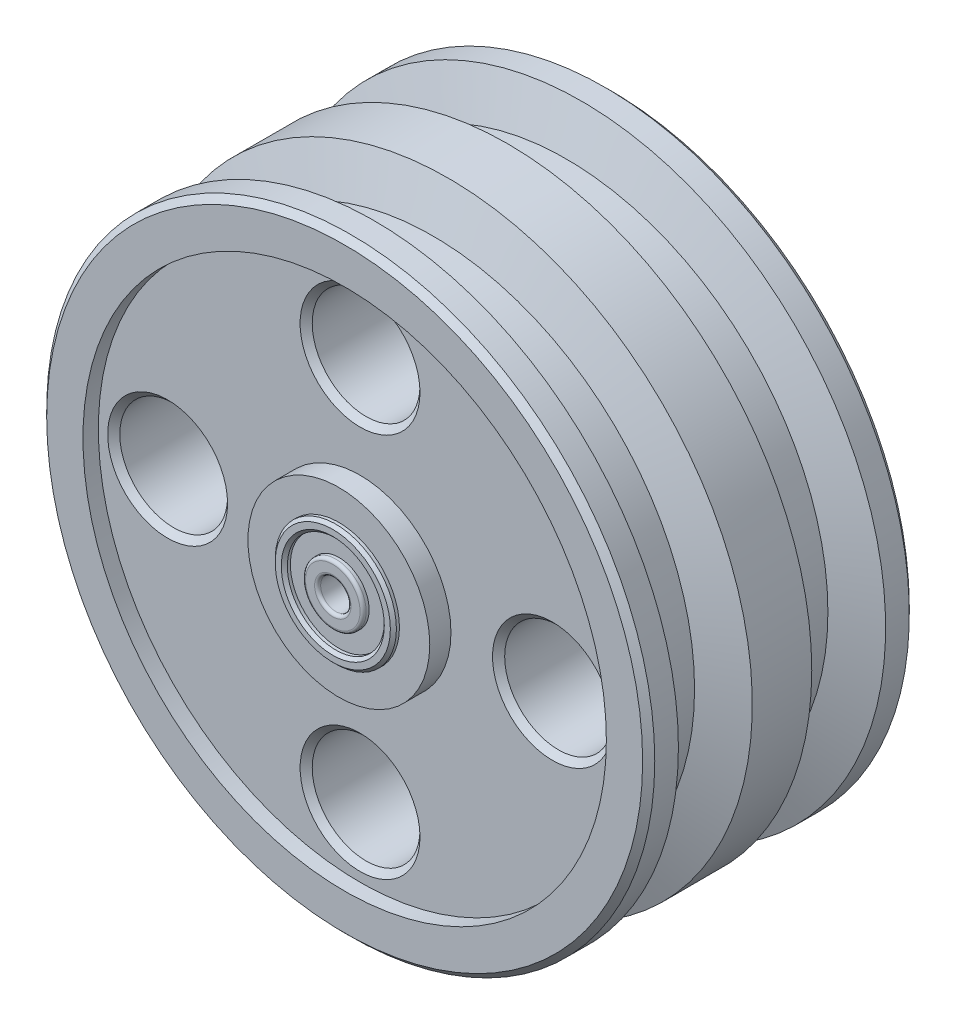
from build123d import *

# Parameters (mm, degrees)
SKETCH2_R            = 50.165
BOSS_EXTRUDE1_DEPTH  = 10
SKETCH4_R            = 43.18
BOSS_EXTRUDE2_DEPTH  = 2
SKETCH5_R            = 50.165
BOSS_EXTRUDE3_DEPTH  = 20
SKETCH7_R            = 43.18
BOSS_EXTRUDE4_DEPTH  = 2
SKETCH8_R            = 50.165
BOSS_EXTRUDE5_DEPTH  = 10
CHAMFER1_SIZE        = 14
CHAMFER1_SIZE_2      = 5.09558328
CHAMFER2_SIZE        = 5.09558328
CHAMFER2_SIZE_2      = 14
CHAMFER4_SIZE        = 14
CHAMFER4_SIZE_2      = 5.09558328
CHAMFER5_SIZE        = 5.09558328
CHAMFER5_SIZE_2      = 14
SKETCH13_R           = 43.18
CUT_EXTRUDE3_DEPTH   = 2.54
SKETCH18_R           = 15
BOSS_EXTRUDE12_DEPTH = 3.5
SKETCH19_R           = 10
BOSS_EXTRUDE13_DEPTH = 1
SKETCH20_R           = 8
SKETCH20_R_2         = 5
CUT_EXTRUDE4_DEPTH   = 1
CUT_EXTRUDE5_START   = -2.54
SKETCH22_R           = 43.18
SKETCH22_R_2         = 15
CUT_EXTRUDE5_DEPTH   = 2.54
SKETCH23_R           = 15
BOSS_EXTRUDE14_DEPTH = 1
BOSS_EXTRUDE15_START = 1
SKETCH24_R           = 10
BOSS_EXTRUDE15_DEPTH = 1
CUT_EXTRUDE6_START   = -1
SKETCH25_R           = 8
SKETCH25_R_2         = 5
CUT_EXTRUDE6_DEPTH   = 1
SKETCH26_R           = 2.5
CUT_EXTRUDE7_DEPTH   = 86.634199068
CHAMFER9_SIZE        = 0.5
FILLET1_R            = 0.5
FILLET2_R            = 0.5
CHAMFER10_SIZE       = 0.5
CHAMFER11_SIZE       = 0.5
FILLET3_R            = 0.5
SKETCH29_R           = 8.89
CUT_EXTRUDE9_DEPTH   = 85.530326215
CHAMFER12_SIZE       = 1
CHAMFER13_SIZE       = 1


with BuildPart() as part:
    # Sketch2 → Boss-Extrude1 (new body)
    with BuildSketch(Plane.XY):
        Circle(SKETCH2_R)
    extrude(amount=-BOSS_EXTRUDE1_DEPTH)

    # Sketch4 → Boss-Extrude2 (add)
    with BuildSketch(Plane(origin=(0, 0, -10), x_dir=(-1, 0, 0), z_dir=(0, 0, -1))):
        with Locations(Location((0, 0, 0), (0, 0, 180))):
            Circle(SKETCH4_R)
    extrude(amount=BOSS_EXTRUDE2_DEPTH)

    # Sketch5 → Boss-Extrude3 (add)
    with BuildSketch(Plane(origin=(0, 0, -12), x_dir=(-1, 0, 0), z_dir=(0, 0, -1))):
        with Locations(Location((0, 0, 0), (0, 0, 180))):
            Circle(SKETCH5_R)
    extrude(amount=BOSS_EXTRUDE3_DEPTH)

    # Sketch7 → Boss-Extrude4 (add)
    with BuildSketch(Plane(origin=(0, 0, -32), x_dir=(-1, 0, 0), z_dir=(0, 0, -1))):
        with Locations(Location((0, 0, 0), (0, 0, 180))):
            Circle(SKETCH7_R)
    extrude(amount=BOSS_EXTRUDE4_DEPTH)

    # Sketch8 → Boss-Extrude5 (add)
    with BuildSketch(Plane(origin=(0, 0, -34), x_dir=(-1, 0, 0), z_dir=(0, 0, -1))):
        with Locations(Location((0, 0, 0), (0, 0, 180))):
            Circle(SKETCH8_R)
    extrude(amount=BOSS_EXTRUDE5_DEPTH)

    # Chamfer1
    # the kernel refuses this chamfer: 14, 5.09558328 mm, written as the material it takes off along each edge
    with BuildSketch(Plane(origin=(0, 0, -10), x_dir=(1, 0, 0), z_dir=(0, -1, 0))) as chamfer1_piece_1_section:
        Polygon((50.165 - CHAMFER1_SIZE, 0), (50.165, CHAMFER1_SIZE_2), (50.165, 0), align=None)
    chamfer1_piece_1 = revolve(axis=Axis((0, 0, -10), (0, 0, 1)), mode=Mode.PRIVATE)
    chamfer1_piece_1 = chamfer1_piece_1 - Plane(origin=(0, 0, -6.275641512), x_dir=(1, 0, 0), z_dir=(0, 0, 1)) * Cylinder(43.18, 201, mode=Mode.PRIVATE)
    add(chamfer1_piece_1, mode=Mode.SUBTRACT)

    # Chamfer2
    # the kernel refuses this chamfer: 14, 5.09558328 mm, written as the material it takes off along each edge
    with BuildSketch(Plane(origin=(0, 0, -12), x_dir=(1, 0, 0), z_dir=(0, 1, 0))) as chamfer2_piece_1_section:
        Polygon((50.165, CHAMFER2_SIZE), (50.165 - CHAMFER2_SIZE_2, 0), (50.165, 0), align=None)
    chamfer2_piece_1 = revolve(axis=Axis((0, 0, -12), (0, 0, -1)), mode=Mode.PRIVATE)
    chamfer2_piece_1 = chamfer2_piece_1 - Plane(origin=(0, 0, -15.724358488), x_dir=(1, 0, 0), z_dir=(0, 0, 1)) * Cylinder(43.18, 201, mode=Mode.PRIVATE)
    add(chamfer2_piece_1, mode=Mode.SUBTRACT)

    # Chamfer4
    # the kernel refuses this chamfer: 14, 5.09558328 mm, written as the material it takes off along each edge
    with BuildSketch(Plane(origin=(0, 0, -32), x_dir=(1, 0, 0), z_dir=(0, 1, 0))) as chamfer4_piece_1_section:
        Polygon((50.165 - CHAMFER4_SIZE, 0), (50.165, -CHAMFER4_SIZE_2), (50.165, 0), align=None)
    chamfer4_piece_1 = revolve(axis=Axis((0, 0, -32), (0, 0, -1)), mode=Mode.PRIVATE)
    chamfer4_piece_1 = chamfer4_piece_1 - Plane(origin=(0, 0, -28.275641512), x_dir=(1, 0, 0), z_dir=(0, 0, 1)) * Cylinder(43.18, 201, mode=Mode.PRIVATE)
    add(chamfer4_piece_1, mode=Mode.SUBTRACT)

    # Chamfer5
    # the kernel refuses this chamfer: 14, 5.09558328 mm, written as the material it takes off along each edge
    with BuildSketch(Plane(origin=(0, 0, -34), x_dir=(1, 0, 0), z_dir=(0, 1, 0))) as chamfer5_piece_1_section:
        Polygon((50.165, CHAMFER5_SIZE), (50.165 - CHAMFER5_SIZE_2, 0), (50.165, 0), align=None)
    chamfer5_piece_1 = revolve(axis=Axis((0, 0, -34), (0, 0, -1)), mode=Mode.PRIVATE)
    chamfer5_piece_1 = chamfer5_piece_1 - Plane(origin=(0, 0, -37.724358488), x_dir=(1, 0, 0), z_dir=(0, 0, 1)) * Cylinder(43.18, 201, mode=Mode.PRIVATE)
    add(chamfer5_piece_1, mode=Mode.SUBTRACT)

    # Sketch13 → Cut-Extrude3 (cut)
    with BuildSketch(Plane.XY):
        Circle(SKETCH13_R)
    extrude(amount=-CUT_EXTRUDE3_DEPTH, mode=Mode.SUBTRACT)

    # Sketch18 → Boss-Extrude12 (add)
    with BuildSketch(Plane.XY.offset(-2.54)):
        Circle(SKETCH18_R)
    extrude(amount=BOSS_EXTRUDE12_DEPTH)

    # Sketch19 → Boss-Extrude13 (add)
    with BuildSketch(Plane.XY.offset(0.96)):
        Circle(SKETCH19_R)
    extrude(amount=BOSS_EXTRUDE13_DEPTH)

    # Sketch20 → Cut-Extrude4 (cut)
    with BuildSketch(Plane.XY.offset(1.96)):
        Circle(SKETCH20_R)
        Circle(SKETCH20_R_2, mode=Mode.SUBTRACT)
    extrude(amount=-CUT_EXTRUDE4_DEPTH, mode=Mode.SUBTRACT)

    # Sketch22 → Cut-Extrude5 (cut)
    with BuildSketch(Plane(origin=(0, 0, -44), x_dir=(-1, 0, 0), z_dir=(0, 0, -1)).offset(CUT_EXTRUDE5_START)):
        with Locations(Location((0, 0, 0), (0, 0, 180))):
            Circle(SKETCH22_R)
        with Locations(Location((0, 0, 0), (0, 0, 180))):
            Circle(SKETCH22_R_2, mode=Mode.SUBTRACT)
    extrude(amount=CUT_EXTRUDE5_DEPTH, mode=Mode.SUBTRACT)

    # Sketch23 → Boss-Extrude14 (add)
    with BuildSketch(Plane(origin=(0, 0, -44), x_dir=(-1, 0, 0), z_dir=(0, 0, -1))):
        with Locations(Location((0, 0, 0), (0, 0, 180))):
            Circle(SKETCH23_R)
    extrude(amount=BOSS_EXTRUDE14_DEPTH)

    # Sketch24 → Boss-Extrude15 (add)
    with BuildSketch(Plane(origin=(0, 0, -45), x_dir=(-1, 0, 0), z_dir=(0, 0, -1)).offset(BOSS_EXTRUDE15_START)):
        with Locations(Location((0, 0, 0), (0, 0, 180))):
            Circle(SKETCH24_R)
    extrude(amount=-BOSS_EXTRUDE15_DEPTH)

    # Sketch25 → Cut-Extrude6 (cut)
    with BuildSketch(Plane(origin=(0, 0, -46), x_dir=(-1, 0, 0), z_dir=(0, 0, -1)).offset(CUT_EXTRUDE6_START)):
        with Locations(Location((0, 0, 0), (0, 0, 180))):
            Circle(SKETCH25_R)
        with Locations(Location((0, 0, 0), (0, 0, 180))):
            Circle(SKETCH25_R_2, mode=Mode.SUBTRACT)
    extrude(amount=CUT_EXTRUDE6_DEPTH, mode=Mode.SUBTRACT)

    # Sketch26 → Cut-Extrude7 (cut, through all)
    with BuildSketch(Plane.XY.offset(1.96)):
        Circle(SKETCH26_R)
    extrude(amount=-CUT_EXTRUDE7_DEPTH, mode=Mode.SUBTRACT)

    # Chamfer9
    chamfer9_edges = [part.edges().sort_by_distance(p)[0] for p in [
        (-10, 0, 1.96),
        (-8, 0, 1.96),
    ]]
    chamfer(chamfer9_edges, length=CHAMFER9_SIZE)

    # Fillet1
    fillet1_edges = [part.edges().sort_by_distance(p)[0] for p in [
        (-5, 0, 1.96),
    ]]
    fillet(fillet1_edges, radius=FILLET1_R)

    # Fillet2
    fillet2_edges = [part.edges().sort_by_distance(p)[0] for p in [
        (-2.5, 0, 1.96),
    ]]
    fillet(fillet2_edges, radius=FILLET2_R)

    # Chamfer10
    chamfer10_edges = [part.edges().sort_by_distance(p)[0] for p in [
        (-10, 0, -46),
        (-8, 0, -46),
    ]]
    chamfer(chamfer10_edges, length=CHAMFER10_SIZE)

    # Chamfer11
    chamfer11_edges = [part.edges().sort_by_distance(p)[0] for p in [
        (-5, 0, -46),
    ]]
    chamfer(chamfer11_edges, length=CHAMFER11_SIZE)

    # Fillet3
    fillet3_edges = [part.edges().sort_by_distance(p)[0] for p in [
        (-2.5, 0, -46),
    ]]
    fillet(fillet3_edges, radius=FILLET3_R)

    # Sketch29 → Cut-Extrude9 (cut, through all)
    with BuildSketch(Plane(origin=(0, 0, -44), x_dir=(-1, 0, 0), z_dir=(0, 0, -1))):
        with Locations((0, 31.75)):
            Circle(SKETCH29_R)
        with Locations((31.75, 0)):
            Circle(SKETCH29_R)
        with Locations((0, -31.75)):
            Circle(SKETCH29_R)
        with Locations((-31.75, 0)):
            Circle(SKETCH29_R)
    extrude(amount=-CUT_EXTRUDE9_DEPTH, mode=Mode.SUBTRACT)

    # Chamfer12
    chamfer12_edges = [part.edges().sort_by_distance(p)[0] for p in [
        (8.89, 31.75, -2.54),
        (8.89, 31.75, -41.46),
        (-22.86, 0, -2.54),
        (-22.86, 0, -41.46),
        (8.89, -31.75, -2.54),
        (8.89, -31.75, -41.46),
        (40.64, 0, -2.54),
        (40.64, 0, -41.46),
    ]]
    chamfer(chamfer12_edges, length=CHAMFER12_SIZE)

    # Chamfer13
    chamfer13_edges = [part.edges().sort_by_distance(p)[0] for p in [
        (-50.165, 0, 0),
        (-50.165, 0, -44),
    ]]
    chamfer(chamfer13_edges, length=CHAMFER13_SIZE)


solid = part.part
